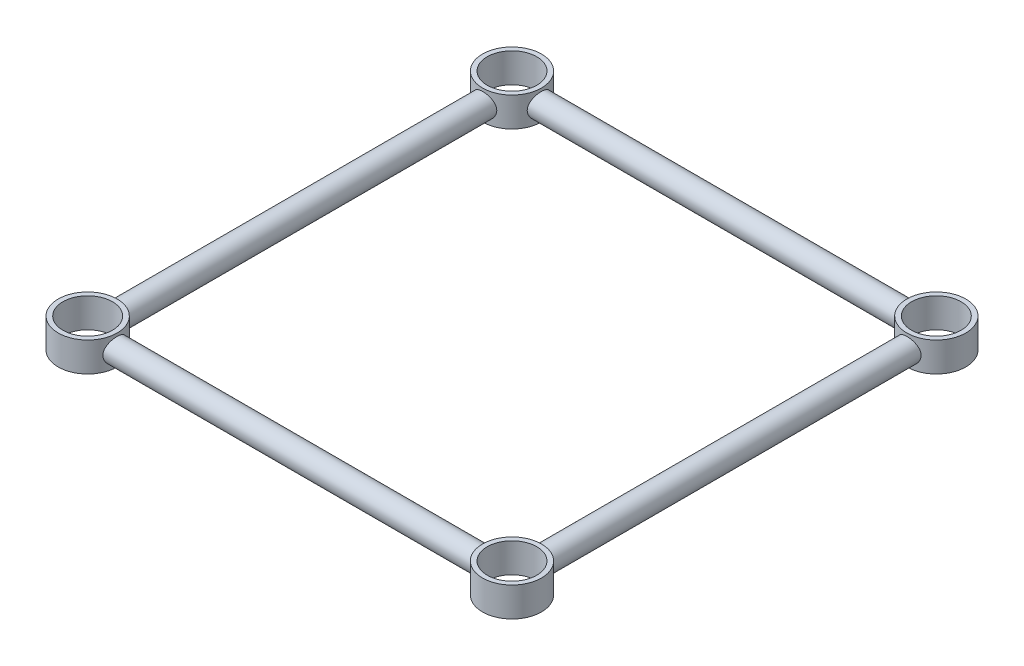
from build123d import *

# Parameters (mm, degrees)
SKETCH2_R               = 15.875
SKETCH2_R_2             = 13.335
BOSS_EXTRUDE1_DEPTH     = 7.9375
CIRPATTERN2_COUNT       = 4
BOSS_EXTRUDE2_START     = -99.750322269
BOSS_EXTRUDE2_OUTLINE_R = 6.35
BOSS_EXTRUDE2_DEPTH     = 199.500644538
CIRPATTERN4_COUNT       = 4


# Read off the part's stored shape, not the designer's step: Boss-Extrude2
with BuildPart() as part:
    # Sketch2 → Boss-Extrude1 (new, symmetric)
    with BuildSketch(Plane(origin=(0, 0, 0), x_dir=(1, 0, 0), z_dir=(0, 1, 0))):
        with Locations(Location((-114.3, 114.3, 0), (0, 0, 270))):
            Circle(SKETCH2_R)
        with Locations(Location((-114.3, 114.3, 0), (0, 0, 270))):
            Circle(SKETCH2_R_2, mode=Mode.SUBTRACT)
    extrude(amount=BOSS_EXTRUDE1_DEPTH, both=True)


with BuildPart() as cirpattern2_1:
    # CirPattern2: pattern copy
    add(part.part.rotate(Axis((0, 0, 0), (0, 1, 0)), 1 * 360 / CIRPATTERN2_COUNT))


with BuildPart() as cirpattern2_2:
    # CirPattern2: pattern copy
    add(part.part.rotate(Axis((0, 0, 0), (0, 1, 0)), 2 * 360 / CIRPATTERN2_COUNT))


with BuildPart() as cirpattern2_3:
    # CirPattern2: pattern copy
    add(part.part.rotate(Axis((0, 0, 0), (0, 1, 0)), 3 * 360 / CIRPATTERN2_COUNT))


with BuildPart() as part_1:
    add(part.part)

    add(cirpattern2_1.part)  # Boss-Extrude2 merges CirPattern2_1
    # Boss-Extrude2 outline → Boss-Extrude2 (add)
    with BuildSketch(Plane.XY.offset(BOSS_EXTRUDE2_START)):
        with Locations((-114.3, 0)):
            Circle(BOSS_EXTRUDE2_OUTLINE_R)
    boss_extrude2 = extrude(amount=BOSS_EXTRUDE2_DEPTH)

    add(cirpattern2_2.part)  # CirPattern4 merges CirPattern2_2

    add(cirpattern2_3.part)  # CirPattern4 merges CirPattern2_3
    # CirPattern4: Boss-Extrude2 ×4 about axis
    cirpattern4_axis = Axis((0, 8.73125, 0), (0, -1, 0))
    for i in range(1, CIRPATTERN4_COUNT):
        add(boss_extrude2.rotate(cirpattern4_axis, i * 360 / CIRPATTERN4_COUNT))


solid = part_1.part
